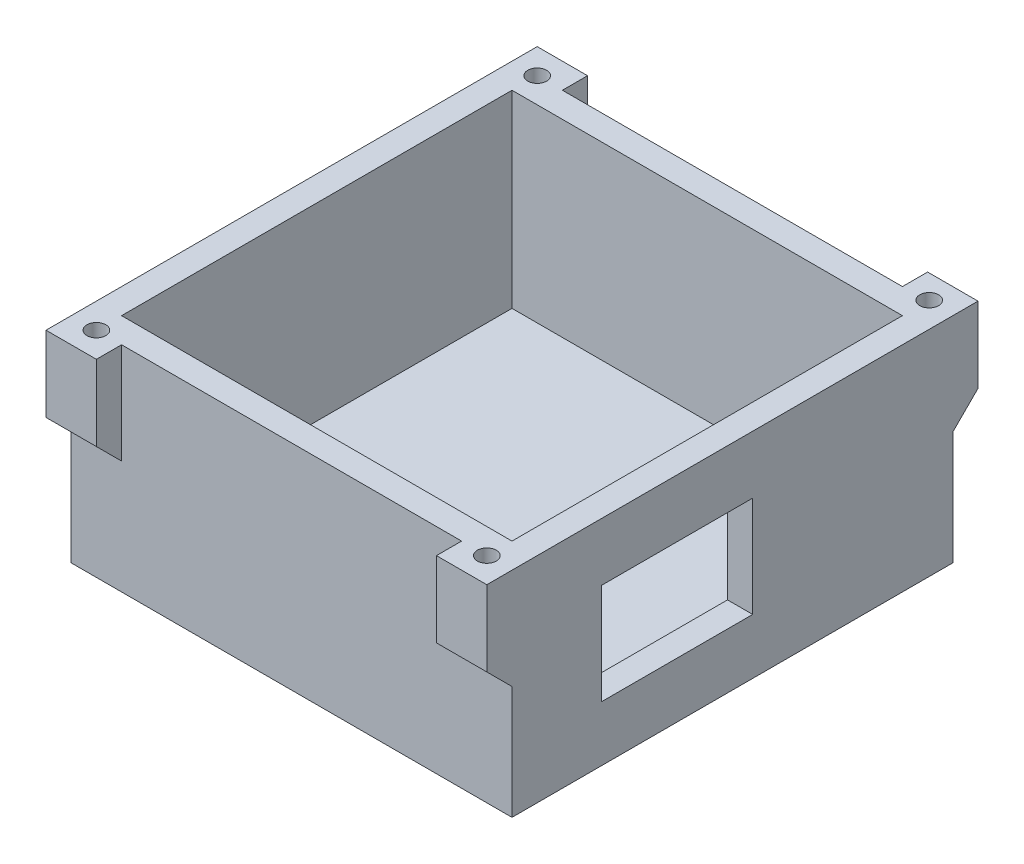
from build123d import *

# Parameters (mm, degrees)
SKETCH1_W           = 35
SKETCH1_H           = 35
SKETCH1_W_2         = 31
SKETCH1_H_2         = 31
BOSS_EXTRUDE1_DEPTH = 2
SKETCH1_3_W         = 35
SKETCH1_3_H         = 35
SKETCH1_3_W_2       = 31
SKETCH1_3_H_2       = 31
BOSS_EXTRUDE2_DEPTH = 17
SKETCH2_W           = 12
SKETCH2_H           = 8
CUT_EXTRUDE1_DEPTH  = 15
SKETCH3_W           = 4
SKETCH3_H           = 2
BOSS_EXTRUDE3_DEPTH = 6
CHAMFER1_SIZE       = 2
SKETCH4_R           = 0.75
CUT_EXTRUDE2_DEPTH  = 6


with BuildPart() as part:
    # Sketch1 → Boss-Extrude1 (new body)
    # profile 1 of 2: a face of its own
    with BuildSketch(Plane(origin=(0, 0, 0), x_dir=(1, 0, 0), z_dir=(0, 1, 0))):
        with Locations((15.5, 15.5)):
            Rectangle(SKETCH1_W, SKETCH1_H)
        with Locations((15.5, 15.5)):
            Rectangle(SKETCH1_W_2, SKETCH1_H_2, mode=Mode.SUBTRACT)
    # profile 2 of 2: a face of its own
    with BuildSketch(Plane(origin=(0, 0, 0), x_dir=(1, 0, 0), z_dir=(0, 1, 0))):
        with Locations((15.5, 15.5)):
            Rectangle(SKETCH1_W_2, SKETCH1_H_2)
    extrude(amount=BOSS_EXTRUDE1_DEPTH)

    # Sketch1<3> → Boss-Extrude2 (add)
    with BuildSketch(Plane(origin=(0, 0, 0), x_dir=(1, 0, 0), z_dir=(0, 1, 0))):
        with Locations((15.5, 15.5)):
            Rectangle(SKETCH1_3_W, SKETCH1_3_H)
        with Locations((15.5, 15.5)):
            Rectangle(SKETCH1_3_W_2, SKETCH1_3_H_2, mode=Mode.SUBTRACT)
    extrude(amount=BOSS_EXTRUDE2_DEPTH)

    # Sketch2 → Cut-Extrude1 (cut)
    with BuildSketch(Plane(origin=(33, 0, 0), x_dir=(0, 0, -1), z_dir=(1, 0, 0))):
        with Locations((11.111303283, 8.4)):
            Rectangle(SKETCH2_W, SKETCH2_H)
    extrude(amount=-CUT_EXTRUDE1_DEPTH, mode=Mode.SUBTRACT)

    # Sketch3 → Boss-Extrude3 (add)
    with BuildSketch(Plane(origin=(0, 17, 0), x_dir=(1, 0, 0), z_dir=(0, 1, 0))):
        with Locations((31, 34)):
            Rectangle(SKETCH3_W, SKETCH3_H)
        with Locations((0, 34)):
            Rectangle(SKETCH3_W, SKETCH3_H)
        with Locations((0, -3)):
            Rectangle(SKETCH3_W, SKETCH3_H)
        with Locations((31, -3)):
            Rectangle(SKETCH3_W, SKETCH3_H)
    extrude(amount=-BOSS_EXTRUDE3_DEPTH)

    # Chamfer1
    chamfer1_edges = [part.edges().sort_by_distance(p)[0] for p in [
        (31, 11, 2),
        (0, 11, 2),
        (0, 11, -33),
        (31, 11, -33),
    ]]
    chamfer(chamfer1_edges, length=CHAMFER1_SIZE - 0.0001)  # a hair under: the kernel refuses the full size

    # Sketch4 → Cut-Extrude2 (cut)
    with BuildSketch(Plane(origin=(0, 17, 0), x_dir=(1, 0, 0), z_dir=(0, 1, 0))):
        with Locations(Location((31, 33.122538924, 0), (0, 0, 270))):
            Circle(SKETCH4_R)
        with Locations(Location((31, -2, 0), (0, 0, 270))):
            Circle(SKETCH4_R)
        with Locations(Location((0, -2, 0), (0, 0, 270))):
            Circle(SKETCH4_R)
        with Locations(Location((0, 33, 0), (0, 0, 270))):
            Circle(SKETCH4_R)
    extrude(amount=-CUT_EXTRUDE2_DEPTH, mode=Mode.SUBTRACT)


solid = part.part
